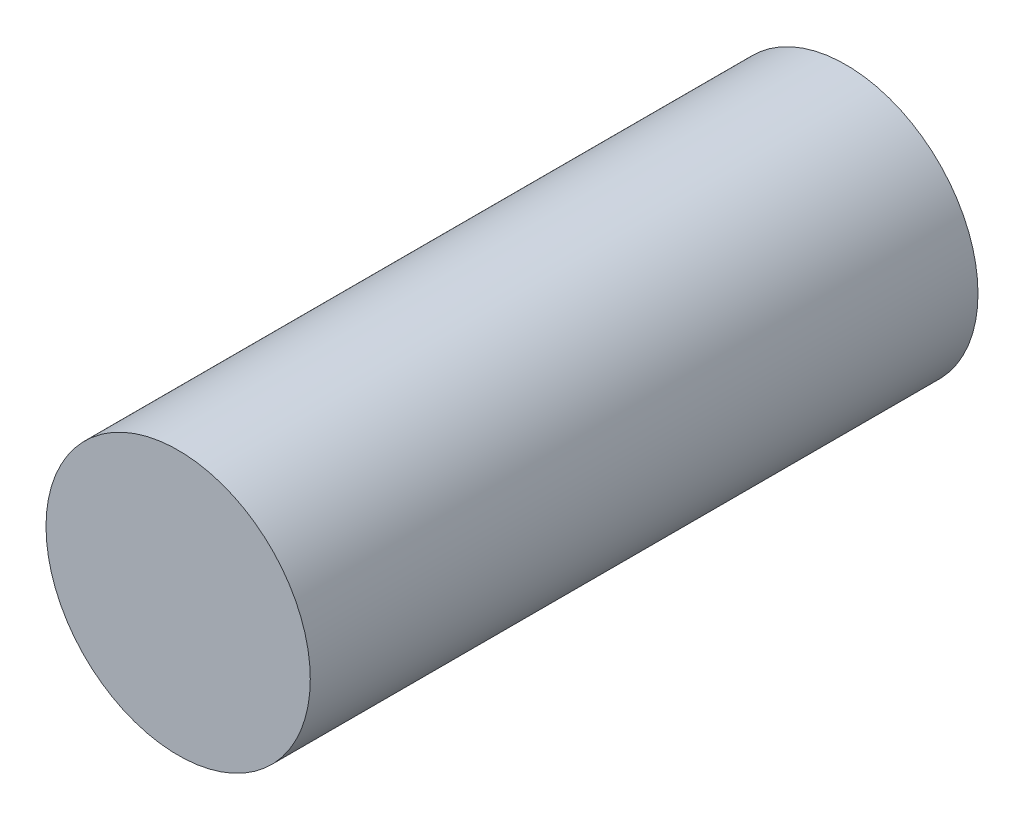
from build123d import *

# Parameters (mm, degrees)
SKETCH1_R           = 30.1625
BOSS_EXTRUDE1_DEPTH = 152.4


with BuildPart() as part:
    # Sketch1 → Boss-Extrude1 (new body)
    with BuildSketch(Plane.XY):
        Circle(SKETCH1_R)
    extrude(amount=BOSS_EXTRUDE1_DEPTH)


solid = part.part
